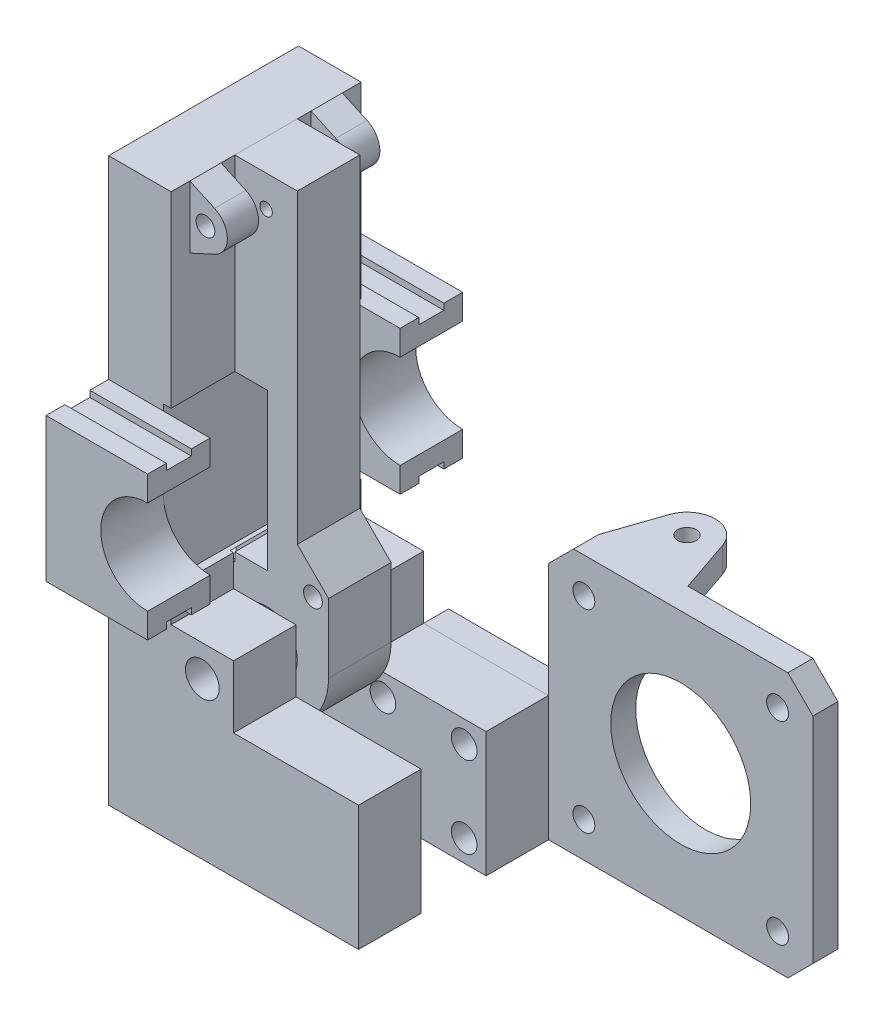
from build123d import *

# Parameters (mm, degrees)
BOSS_EXTRUDE1_START          = -5.2
SKETCH1_R                    = 2.7
BOSS_EXTRUDE1_DEPTH          = 10
BOSS_EXTRUDE3_START          = 5.2
SKETCH1_2_R                  = 2.7
BOSS_EXTRUDE3_DEPTH          = 10
SKETCH2_R                    = 5
SKETCH2_R_2                  = 1
BOSS_EXTRUDE2_DEPTH          = 5
BOSS_EXTRUDE4_DEPTH          = 5.2
CUT_EXTRUDE1_DEPTH           = 69.782555928
CUT_EXTRUDE1_DEPTH_BACK      = 69.782555928
SKETCH4_W                    = 2.5
SKETCH4_H                    = 25
BOSS_EXTRUDE5_START          = 15.2
BOSS_EXTRUDE5_DEPTH          = 10
BOSS_EXTRUDE6_START          = -25.2
BOSS_EXTRUDE6_DEPTH          = 10
CHAMFER1_SIZE                = 5
SKETCH6_R                    = 1.5
BOSS_EXTRUDE7_DEPTH          = 5
SKETCH7_W                    = 10
SKETCH7_H                    = 20
BOSS_EXTRUDE8_DEPTH          = 15.2
BOSS_EXTRUDE9_START          = -8
SKETCH8_R                    = 1.5
BOSS_EXTRUDE9_DEPTH          = 5
SKETCH9_W                    = 4
SKETCH9_H                    = 2
CUT_EXTRUDE2_DEPTH           = 70.275554852
SKETCH10_R                   = 1.5
CUT_EXTRUDE3_DEPTH           = 8
CUT_EXTRUDE3_DRAFT           = -8
CUT_EXTRUDE3_PROFILE_2_DEPTH = 8
CUT_EXTRUDE3_PROFILE_2_DRAFT = -8
CUT_EXTRUDE3_PROFILE_3_DEPTH = 8
CUT_EXTRUDE3_PROFILE_3_DRAFT = -8
CUT_EXTRUDE3_PROFILE_4_DEPTH = 8
CUT_EXTRUDE3_PROFILE_4_DRAFT = -8
SKETCH11_R                   = 2.05
SKETCH11_R_2                 = 1.75
CUT_EXTRUDE4_DEPTH           = 10
SKETCH12_R                   = 1.75
SKETCH12_R_2                 = 11.2
BOSS_EXTRUDE10_DEPTH         = 4
CHAMFER2_SIZE                = 4
SKETCH11_3_R                 = 1.75
CUT_EXTRUDE5_DEPTH           = 103.271452517
SKETCH14_R                   = 1.5
BOSS_EXTRUDE11_DEPTH         = 4
BOSS_EXTRUDE12_REACH         = 97.889


with BuildPart() as part:
    # Sketch1 → Boss-Extrude1 (new body)
    with BuildSketch(Plane.XY.offset(BOSS_EXTRUDE1_START)):
        Polygon((-10, 0), (-10, -10), (-10, -30), (30, -30), (30, -10), (10, -10), (10, 0), (0, 0), (0, 40), (-10, 40), align=None)
        with Locations((5, -5)):
            Circle(SKETCH1_R, mode=Mode.SUBTRACT)
    extrude(amount=-BOSS_EXTRUDE1_DEPTH)



with BuildPart() as body_2:
    # Sketch1<2> → Boss-Extrude3 (new body)
    with BuildSketch(Plane.XY.offset(BOSS_EXTRUDE3_START)):
        Polygon((-10, 0), (-10, -10), (-10, -30), (30, -30), (30, -10), (10, -10), (10, 0), (0, 0), (0, 40), (-10, 40), align=None)
        with Locations((5, -5)):
            Circle(SKETCH1_2_R, mode=Mode.SUBTRACT)
    extrude(amount=BOSS_EXTRUDE3_DEPTH)


with BuildPart() as body_3:
    # Sketch2 → Boss-Extrude2 (new, symmetric)
    with BuildSketch(Plane.XY):
        with BuildLine():
            Line((0, 60), (10, 60))
            Line((10, 60), (10, 3.660254038))
            ThreePointArc((10, 3.660254038), (5, -15), (0, 3.660254038))
            Line((0, 3.660254038), (0, 60))
        make_face()
        with Locations((5, -5)):
            Circle(SKETCH2_R, mode=Mode.SUBTRACT)
        with Locations((5, 55)):
            Circle(SKETCH2_R_2, mode=Mode.SUBTRACT)
    extrude(amount=BOSS_EXTRUDE2_DEPTH, both=True)


with BuildPart() as part_1:
    add(part.part)

    add(body_2.part)  # Boss-Extrude4 merges body 2
    # Sketch3 → Boss-Extrude4 (add, symmetric)
    with BuildSketch(Plane.XY):
        Polygon((-10, 40), (0, 40), (0, 5.556349186), (-10, -4.443650814), align=None)
    extrude(amount=BOSS_EXTRUDE4_DEPTH, both=True)


with BuildPart() as cut_extrude1_tool:
    # Sketch4 → Cut-Extrude1 (new, two sides: drawn at the far end of the back side and taken through both)
    with BuildSketch(Plane.XY.offset(-CUT_EXTRUDE1_DEPTH_BACK)):
        with Locations((0, 17.5)):
            Rectangle(SKETCH4_W, SKETCH4_H)
    extrude(amount=CUT_EXTRUDE1_DEPTH + CUT_EXTRUDE1_DEPTH_BACK)


with BuildPart() as part_2:
    add(part_1.part)

    # Cut-Extrude1: cut by cut_extrude1_tool
    add(cut_extrude1_tool.part, mode=Mode.SUBTRACT)

    # Sketch5 → Boss-Extrude5 (add)
    with BuildSketch(Plane.XY.offset(BOSS_EXTRUDE5_START)):
        with BuildLine():
            Line((6.25, 29), (-10, 29))
            Line((-10, 29), (-10, 6))
            Line((-10, 6), (6.25, 6))
            Line((6.25, 6), (6.25, 10))
            ThreePointArc((6.25, 10), (-1.25, 17.5), (6.25, 25))
            Line((6.25, 25), (6.25, 29))
        make_face()
    extrude(amount=BOSS_EXTRUDE5_DEPTH)

    # Sketch5<2> → Boss-Extrude6 (add)
    with BuildSketch(Plane.XY.offset(BOSS_EXTRUDE6_START)):
        with BuildLine():
            Line((6.25, 29), (-10, 29))
            Line((-10, 29), (-10, 6))
            Line((-10, 6), (6.25, 6))
            Line((6.25, 6), (6.25, 10))
            ThreePointArc((6.25, 10), (-1.25, 17.5), (6.25, 25))
            Line((6.25, 25), (6.25, 29))
        make_face()
    extrude(amount=BOSS_EXTRUDE6_DEPTH)

    # Sketch7 → Boss-Extrude8 (add, symmetric)
    with BuildSketch(Plane.XY):
        with Locations((-5, 50)):
            Rectangle(SKETCH7_W, SKETCH7_H)
    extrude(amount=BOSS_EXTRUDE8_DEPTH, both=True)

    # Sketch8 → Boss-Extrude9 (add)
    with BuildSketch(Plane(origin=(0, 0, -15.2), x_dir=(-1, 0, 0), z_dir=(0, 0, -1)).offset(BOSS_EXTRUDE9_START)):
        with BuildLine():
            Line((-3.960983408, 51.819508296), (0, 50))
            Line((0, 50), (0, 60))
            Line((0, 60), (-3.960983408, 58.180491704))
            ThreePointArc((-3.960983408, 58.180491704), (-6, 55), (-3.960983408, 51.819508296))
        make_face()
        with Locations((-2.5, 55)):
            Circle(SKETCH8_R, mode=Mode.SUBTRACT)
    boss_extrude9 = extrude(amount=BOSS_EXTRUDE9_DEPTH)

    # Mirror1: Boss-Extrude9 across plane
    add(boss_extrude9.mirror(Plane.XY))

    # Sketch9 → Cut-Extrude2 (cut, through all)
    with BuildSketch(Plane(origin=(6.25, 0, 0), x_dir=(0, 0, -1), z_dir=(1, 0, 0))):
        with Locations((20.2, 29)):
            Rectangle(SKETCH9_W, SKETCH9_H)
        with Locations((20.2, 6)):
            Rectangle(SKETCH9_W, SKETCH9_H)
        with Locations((-20.2, 6)):
            Rectangle(SKETCH9_W, SKETCH9_H)
        with Locations((-20.2, 29)):
            Rectangle(SKETCH9_W, SKETCH9_H)
    extrude(amount=-CUT_EXTRUDE2_DEPTH, mode=Mode.SUBTRACT)


with BuildPart() as body_3_1:
    add(body_3.part)

    # Cut-Extrude1: cut by cut_extrude1_tool
    add(cut_extrude1_tool.part, mode=Mode.SUBTRACT)

    # Chamfer1
    chamfer1_edges = [body_3_1.edges().sort_by_distance(p)[0] for p in [
        (1.25, 17.5, -5),
        (1.25, 17.5, 5),
    ]]
    chamfer(chamfer1_edges, length=CHAMFER1_SIZE - 0.0001)  # a hair under: the kernel refuses the full size

    # Sketch6 → Boss-Extrude7 (add, symmetric)
    with BuildSketch(Plane.XY):
        with BuildLine():
            Line((10, 11.035533906), (10, 3.660254038))
            ThreePointArc((10, 3.660254038), (13.660254038, 0), (15, -5))
            Line((15, -5), (15, 6.035533906))
            Line((15, 6.035533906), (10, 11.035533906))
        make_face()
        with Locations((12.5, 5)):
            Circle(SKETCH6_R, mode=Mode.SUBTRACT)
    extrude(amount=BOSS_EXTRUDE7_DEPTH, both=True)

    # Sketch15 → Boss-Extrude12 (add, up to next)
    with BuildSketch(Plane(origin=(0, 5, 0), x_dir=(1, 0, 0), z_dir=(0, 1, 0)), mode=Mode.PRIVATE) as boss_extrude12_sk1:
        Polygon((6.25, -5), (1.25, 0), (6.25, 5), (5.25, 5), (0.25, 0), (5.25, -5), align=None)
    boss_extrude12_tool1 = extrude(boss_extrude12_sk1.sketch, amount=BOSS_EXTRUDE12_REACH, mode=Mode.PRIVATE) - body_3_1.part
    add(boss_extrude12_tool1.solids().sort_by_distance((3.667538, 5, 2.582462))[0])


with BuildPart() as cut_extrude3_tool:
    # Sketch10 → Cut-Extrude3 (with draft: the straight prism first)
    with BuildSketch(Plane.ZY.offset(10)):
        with Locations((12.2, -27)):
            Circle(SKETCH10_R)
    extrude(amount=-CUT_EXTRUDE3_DEPTH)
    # Cut-Extrude3: the draft: its side faces are tilted about the plane it starts from
    cut_extrude3_sides = [cut_extrude3_tool.faces().sort_by_distance(p)[0] for p in [
        (-6, -27, 10.7),
    ]]
    draft(cut_extrude3_sides, Plane.ZY.offset(10), CUT_EXTRUDE3_DRAFT)


with BuildPart() as part_3:
    add(part_2.part)

    # Cut-Extrude3: cut by cut_extrude3_tool
    add(cut_extrude3_tool.part, mode=Mode.SUBTRACT)


with BuildPart() as cut_extrude3_profile_2_tool:
    # Sketch10 → Cut-Extrude3 profile 2 (with draft: the straight prism first)
    with BuildSketch(Plane.ZY.offset(10)):
        with Locations((-12.2, -27)):
            Circle(SKETCH10_R)
    extrude(amount=-CUT_EXTRUDE3_PROFILE_2_DEPTH)
    # Cut-Extrude3 profile 2: the draft: its side faces are tilted about the plane it starts from
    cut_extrude3_profile_2_sides = [cut_extrude3_profile_2_tool.faces().sort_by_distance(p)[0] for p in [
        (-6, -27, -13.7),
    ]]
    draft(cut_extrude3_profile_2_sides, Plane.ZY.offset(10), CUT_EXTRUDE3_PROFILE_2_DRAFT)


with BuildPart() as part_4:
    add(part_3.part)

    # Cut-Extrude3 profile 2: cut by cut_extrude3_profile_2_tool
    add(cut_extrude3_profile_2_tool.part, mode=Mode.SUBTRACT)


with BuildPart() as cut_extrude3_profile_3_tool:
    # Sketch10 → Cut-Extrude3 profile 3 (with draft: the straight prism first)
    with BuildSketch(Plane.ZY.offset(10)):
        with Locations((-12.2, 57)):
            Circle(SKETCH10_R)
    extrude(amount=-CUT_EXTRUDE3_PROFILE_3_DEPTH)
    # Cut-Extrude3 profile 3: the draft: its side faces are tilted about the plane it starts from
    cut_extrude3_profile_3_sides = [cut_extrude3_profile_3_tool.faces().sort_by_distance(p)[0] for p in [
        (-6, 57, -13.7),
    ]]
    draft(cut_extrude3_profile_3_sides, Plane.ZY.offset(10), CUT_EXTRUDE3_PROFILE_3_DRAFT)


with BuildPart() as part_5:
    add(part_4.part)

    # Cut-Extrude3 profile 3: cut by cut_extrude3_profile_3_tool
    add(cut_extrude3_profile_3_tool.part, mode=Mode.SUBTRACT)


with BuildPart() as cut_extrude3_profile_4_tool:
    # Sketch10 → Cut-Extrude3 profile 4 (with draft: the straight prism first)
    with BuildSketch(Plane.ZY.offset(10)):
        with Locations((12.2, 57)):
            Circle(SKETCH10_R)
    extrude(amount=-CUT_EXTRUDE3_PROFILE_4_DEPTH)
    # Cut-Extrude3 profile 4: the draft: its side faces are tilted about the plane it starts from
    cut_extrude3_profile_4_sides = [cut_extrude3_profile_4_tool.faces().sort_by_distance(p)[0] for p in [
        (-6, 57, 10.7),
    ]]
    draft(cut_extrude3_profile_4_sides, Plane.ZY.offset(10), CUT_EXTRUDE3_PROFILE_4_DRAFT)


with BuildPart() as part_6:
    add(part_5.part)

    # Cut-Extrude3 profile 4: cut by cut_extrude3_profile_4_tool
    add(cut_extrude3_profile_4_tool.part, mode=Mode.SUBTRACT)

    # Sketch11 → Cut-Extrude4 (cut)
    # profile 1 of 8: a face of its own
    with BuildSketch(Plane(origin=(0, 0, -15.2), x_dir=(-1, 0, 0), z_dir=(0, 0, -1))):
        with Locations((-26.5, -13.5)):
            Circle(SKETCH11_R)
        with Locations((-26.5, -13.5)):
            Circle(SKETCH11_R_2, mode=Mode.SUBTRACT)
    # profile 2 of 8: a face of its own
    with BuildSketch(Plane(origin=(0, 0, -15.2), x_dir=(-1, 0, 0), z_dir=(0, 0, -1))):
        with Locations((-13.5, -13.5)):
            Circle(SKETCH11_R)
        with Locations((-13.5, -13.5)):
            Circle(SKETCH11_R_2, mode=Mode.SUBTRACT)
    # profile 3 of 8: a face of its own
    with BuildSketch(Plane(origin=(0, 0, -15.2), x_dir=(-1, 0, 0), z_dir=(0, 0, -1))):
        with Locations((-13.5, -26.5)):
            Circle(SKETCH11_R)
        with Locations((-13.5, -26.5)):
            Circle(SKETCH11_R_2, mode=Mode.SUBTRACT)
    # profile 4 of 8: a face of its own
    with BuildSketch(Plane(origin=(0, 0, -15.2), x_dir=(-1, 0, 0), z_dir=(0, 0, -1))):
        with Locations((-26.5, -26.5)):
            Circle(SKETCH11_R)
        with Locations((-26.5, -26.5)):
            Circle(SKETCH11_R_2, mode=Mode.SUBTRACT)
    # profile 5 of 8: a face of its own
    with BuildSketch(Plane(origin=(0, 0, -15.2), x_dir=(-1, 0, 0), z_dir=(0, 0, -1))):
        with Locations((-26.5, -26.5)):
            Circle(SKETCH11_R_2)
    # profile 6 of 8: a face of its own
    with BuildSketch(Plane(origin=(0, 0, -15.2), x_dir=(-1, 0, 0), z_dir=(0, 0, -1))):
        with Locations((-13.5, -26.5)):
            Circle(SKETCH11_R_2)
    # profile 7 of 8: a face of its own
    with BuildSketch(Plane(origin=(0, 0, -15.2), x_dir=(-1, 0, 0), z_dir=(0, 0, -1))):
        with Locations((-13.5, -13.5)):
            Circle(SKETCH11_R_2)
    # profile 8 of 8: a face of its own
    with BuildSketch(Plane(origin=(0, 0, -15.2), x_dir=(-1, 0, 0), z_dir=(0, 0, -1))):
        with Locations((-26.5, -13.5)):
            Circle(SKETCH11_R_2)
    extrude(amount=-CUT_EXTRUDE4_DEPTH, mode=Mode.SUBTRACT)


with BuildPart() as body_3_2:
    # Sketch12 → Boss-Extrude10 (new body)
    with BuildSketch(Plane(origin=(0, 0, -15.2), x_dir=(-1, 0, 0), z_dir=(0, 0, -1))):
        Polygon((-30, 12.3), (-30, -10), (-10, -10), (-10, -30), (-30, -30), (-72.3, -30), (-72.3, 12.3), align=None)
        with Locations((-66.65, 6.65)):
            Circle(SKETCH12_R, mode=Mode.SUBTRACT)
        with Locations((-35.65, 6.65)):
            Circle(SKETCH12_R, mode=Mode.SUBTRACT)
        with Locations((-66.65, -24.35)):
            Circle(SKETCH12_R, mode=Mode.SUBTRACT)
        with Locations((-35.65, -24.35)):
            Circle(SKETCH12_R, mode=Mode.SUBTRACT)
        with Locations((-51.15, -8.85)):
            Circle(SKETCH12_R_2, mode=Mode.SUBTRACT)
    extrude(amount=BOSS_EXTRUDE10_DEPTH)

    # Chamfer2
    chamfer2_edges = [body_3_2.edges().sort_by_distance(p)[0] for p in [
        (72.3, -30, -17.2),
        (72.3, 12.3, -17.2),
        (30, 12.3, -17.2),
    ]]
    chamfer(chamfer2_edges, length=CHAMFER2_SIZE)

    # Sketch11<3> → Cut-Extrude5 (cut, through all)
    with BuildSketch(Plane(origin=(0, 0, -15.2), x_dir=(-1, 0, 0), z_dir=(0, 0, -1))):
        with Locations(Location((-26.5, -13.5, 0), (0, 0, 180))):
            Circle(SKETCH11_3_R)
        with Locations(Location((-13.5, -13.5, 0), (0, 0, 180))):
            Circle(SKETCH11_3_R)
        with Locations(Location((-13.5, -26.5, 0), (0, 0, 180))):
            Circle(SKETCH11_3_R)
        with Locations(Location((-26.5, -26.5, 0), (0, 0, 180))):
            Circle(SKETCH11_3_R)
    extrude(amount=CUT_EXTRUDE5_DEPTH, mode=Mode.SUBTRACT)

    # Sketch14 → Boss-Extrude11 (add)
    with BuildSketch(Plane(origin=(0, 12.3, 0), x_dir=(1, 0, 0), z_dir=(0, 1, 0))):
        with BuildLine():
            Line((34, 19.2), (36.892141273, 27.656241414))
            ThreePointArc((36.892141273, 27.656241414), (41.15, 30.7), (45.407858727, 27.656241414))
            Line((45.407858727, 27.656241414), (48.3, 19.2))
            Line((48.3, 19.2), (34, 19.2))
        make_face()
        with Locations(Location((41.15, 26.2, 0), (0, 0, 180))):
            Circle(SKETCH14_R, mode=Mode.SUBTRACT)
    extrude(amount=-BOSS_EXTRUDE11_DEPTH)


solid = Compound([body_3_1.part, part_6.part, body_3_2.part])
